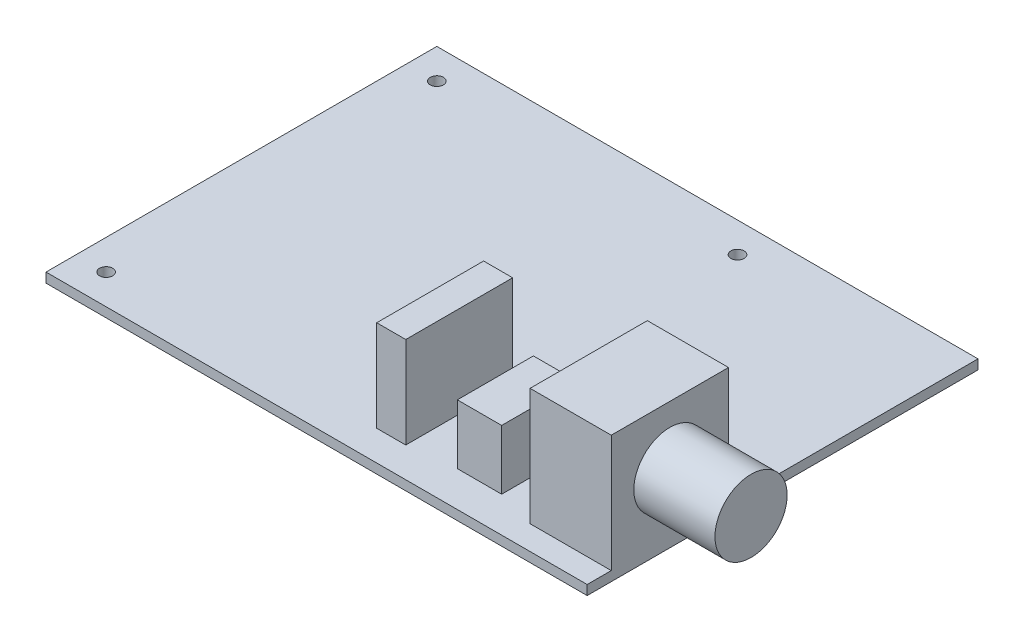
from build123d import *

# Parameters (mm, degrees)
SKETCH1_W                            = 90
SKETCH1_H                            = 65
SKETCH1_R                            = 1.1
BOSS_EXTRUDE1_DEPTH                  = 1.6
SKETCH2_W                            = 29.4
SKETCH2_H                            = 11.5
SKETCH2_W_2                          = 27.4
SKETCH2_H_2                          = 9.5
SKETCH2_W_3                          = 11.4
SKETCH2_W_4                          = 9.4
CELL_AND_THERMISTOR_CONNECTORS_DEPTH = 9.25
SKETCH3_W                            = 13.5
SKETCH3_H                            = 19.5
BOSS_EXTRUDE2_DEPTH                  = 19.5
SKETCH4_R                            = 6
BOSS_EXTRUDE3_DEPTH                  = 13.5
SKETCH5_W                            = 4.83
SKETCH5_H                            = 17.78
JTAG_HEADER_DEPTH                    = 15.2
SKETCH6_W                            = 7.37
SKETCH6_H                            = 12.65
AUX_CAN_HEADER_DEPTH                 = 9.91


with BuildPart() as part:
    # Sketch1 → Boss-Extrude1 (new body)
    with BuildSketch(Plane(origin=(0, 0, 0), x_dir=(1, 0, 0), z_dir=(0, 1, 0))):
        with Locations((45, 32.5)):
            Rectangle(SKETCH1_W, SKETCH1_H)
        with Locations((5, 5)):
            Circle(SKETCH1_R, mode=Mode.SUBTRACT)
        with Locations((5, 60)):
            Circle(SKETCH1_R, mode=Mode.SUBTRACT)
        with Locations((55, 60)):
            Circle(SKETCH1_R, mode=Mode.SUBTRACT)
    extrude(amount=BOSS_EXTRUDE1_DEPTH)

    # Sketch2 → Cell and thermistor connectors (add)
    # profile 1 of 2: a face of its own
    with BuildSketch(Plane.XZ):
        with Locations((29.7, -57.25)):
            Rectangle(SKETCH2_W, SKETCH2_H)
        with Locations((29.7, -57.25)):
            Rectangle(SKETCH2_W_2, SKETCH2_H_2, mode=Mode.SUBTRACT)
    # profile 2 of 2: a face of its own
    with BuildSketch(Plane.XZ):
        with Locations((71.7, -57.25)):
            Rectangle(SKETCH2_W_3, SKETCH2_H)
        with Locations((71.7, -57.25)):
            Rectangle(SKETCH2_W_4, SKETCH2_H_2, mode=Mode.SUBTRACT)
    extrude(amount=CELL_AND_THERMISTOR_CONNECTORS_DEPTH)

    # Sketch3 → Boss-Extrude2 (add)
    with BuildSketch(Plane(origin=(0, 1.6, 0), x_dir=(1, 0, 0), z_dir=(0, 1, 0))):
        with Locations((83.25, 13.757121209)):
            Rectangle(SKETCH3_W, SKETCH3_H)
    extrude(amount=BOSS_EXTRUDE2_DEPTH)

    # Sketch4 → Boss-Extrude3 (add)
    with BuildSketch(Plane(origin=(90, 0, 0), x_dir=(0, 0, -1), z_dir=(1, 0, 0))):
        with Locations((13.757121209, 11.35)):
            Circle(SKETCH4_R)
    extrude(amount=BOSS_EXTRUDE3_DEPTH)

    # Sketch5 → JTAG header (add)
    with BuildSketch(Plane(origin=(0, 1.6, 0), x_dir=(1, 0, 0), z_dir=(0, 1, 0))):
        with Locations((52.415, 13.89)):
            Rectangle(SKETCH5_W, SKETCH5_H)
    extrude(amount=JTAG_HEADER_DEPTH)

    # Sketch6 → Aux. CAN header (add)
    with BuildSketch(Plane(origin=(0, 1.6, 0), x_dir=(1, 0, 0), z_dir=(0, 1, 0))):
        with Locations((66.203516114, 12.216109448)):
            Rectangle(SKETCH6_W, SKETCH6_H)
    extrude(amount=AUX_CAN_HEADER_DEPTH)


solid = part.part
